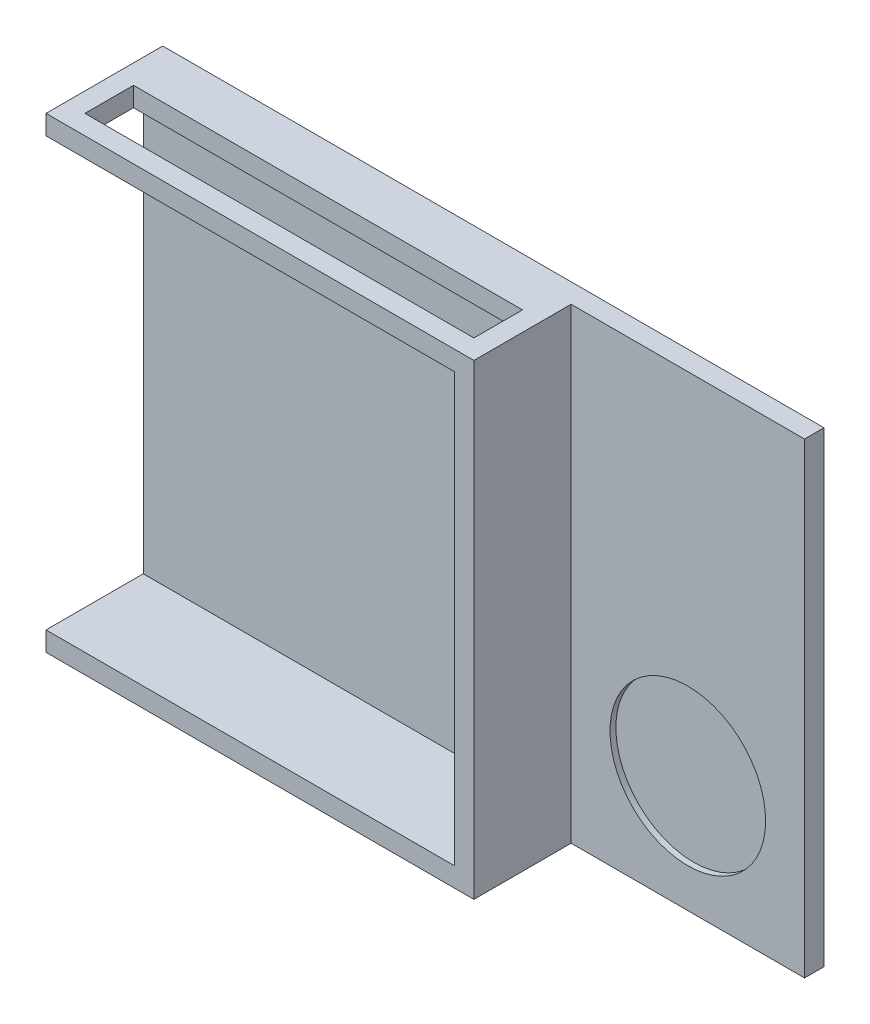
from build123d import *

# Parameters (mm, degrees)
RESSALTO_EXTRUS_O1_DEPTH   = 10
ESBO_O2_W                  = 10
ESBO_O2_H                  = 10
ESBO_O2_W_2                = 210
ESBO_O2_H_2                = 220
RESSALTO_EXTRUS_O4_DEPTH   = 50
ESBO_O7_R                  = 40
CORTE_EXTRUS_O1_DEPTH      = 3
ESBO_O21_W                 = 200
ESBO_O21_H                 = 25
CORTE_EXTRUS_O5_DEPTH      = 100
CORTE_EXTRUS_O6_DEPTH      = 161.25
CORTE_EXTRUS_O6_DEPTH_BACK = 1.25
ESBO_O23_W                 = 150
ESBO_O23_H                 = 5


with BuildPart() as part:
    # Esboço1 → Ressalto-extrusão1 (new body)
    with BuildSketch(Plane.XY):
        Polygon((-99.217703787, 25.02394247), (70.782296213, 25.02394247), (70.782296213, 0), (70.782296213, -214.97605753), (-99.217703787, -214.97605753), (-269.217703787, -214.97605753), (-269.217703787, 0), (-269.217703787, 25.02394247), align=None)
    extrude(amount=RESSALTO_EXTRUS_O1_DEPTH)

    # Esboço2 → Ressalto-extrusão4 (add)
    with BuildSketch(Plane.XY.offset(10)):
        with Locations((-54.217703787, -209.97605753)):
            Rectangle(ESBO_O2_W, ESBO_O2_H)
        with Locations((-164.217703787, -209.97605753)):
            Rectangle(ESBO_O2_W_2, ESBO_O2_H)
        with Locations((-54.217703787, -94.97605753)):
            Rectangle(ESBO_O2_W, ESBO_O2_H_2)
        Polygon((-59.217703787, 15.02394247), (-49.217703787, 15.02394247), (-49.217703787, 25.02394247), (-269.217703787, 25.02394247), (-269.217703787, 15.02394247), align=None)
    extrude(amount=RESSALTO_EXTRUS_O4_DEPTH)

    # Esboço7 → Corte-extrusão1 (cut)
    with BuildSketch(Plane.XY.offset(10)):
        with Locations((10.782296213, -154.97605753)):
            Circle(ESBO_O7_R)
    extrude(amount=-CORTE_EXTRUS_O1_DEPTH, mode=Mode.SUBTRACT)

    # Esboço21 → Corte-extrusão5 (cut)
    with BuildSketch(Plane(origin=(0, 25.02394247, 0), x_dir=(1, 0, 0), z_dir=(0, 1, 0))):
        with Locations((-159.217703787, -37.5)):
            Rectangle(ESBO_O21_W, ESBO_O21_H)
    extrude(amount=-CORTE_EXTRUS_O5_DEPTH, mode=Mode.SUBTRACT)

    # Esboço23 → Corte-extrusão6 (cut, two sides: drawn at the far end of the back side and taken through both)
    with BuildSketch(Plane.XZ.offset(-15.02394247).offset(-CORTE_EXTRUS_O6_DEPTH_BACK)):
        with Locations((-194.217703787, 55)):
            Rectangle(ESBO_O23_W, ESBO_O23_H)
    extrude(amount=CORTE_EXTRUS_O6_DEPTH + CORTE_EXTRUS_O6_DEPTH_BACK, mode=Mode.SUBTRACT)


solid = part.part
